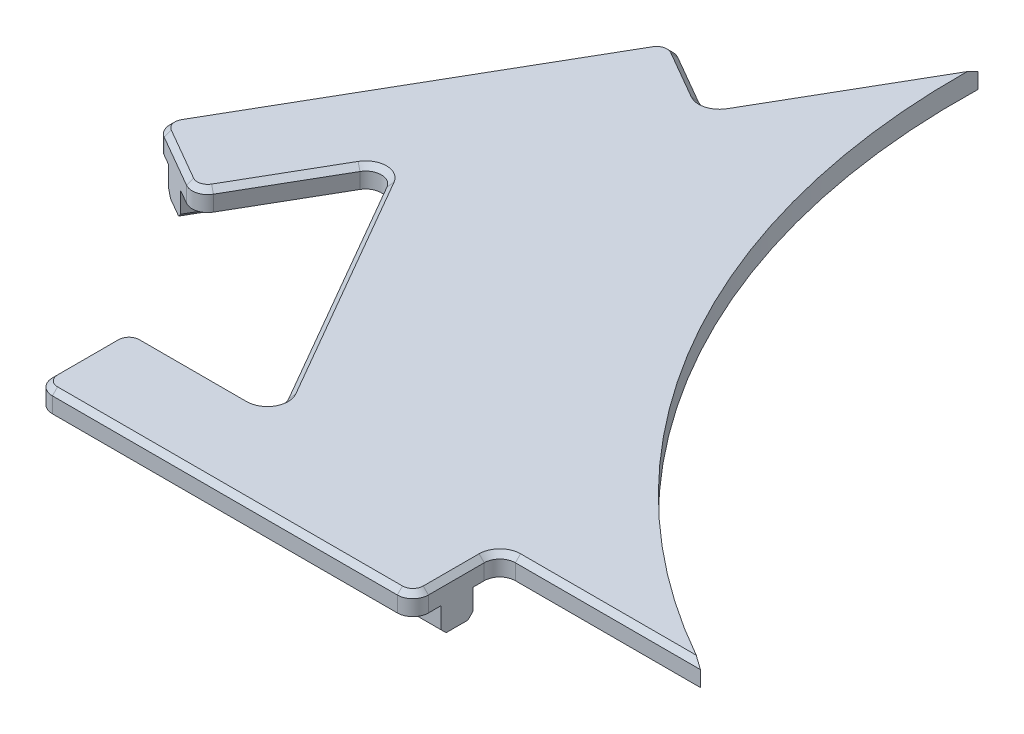
from build123d import *

# Parameters (mm, degrees)
BOSS_EXTRUDE1_DEPTH = 4
FILLET1_R           = 3
CUT_EXTRUDE1_DEPTH  = 209.07209361882713
FILLET4_R           = 3
CHAMFER1_SIZE       = 1
SKETCH3_R           = 140.00000000000003
CUT_EXTRUDE2_DEPTH  = 209.07209361882713
BOSS_EXTRUDE2_DEPTH = 5
CHAMFER2_SIZE       = 1


with BuildPart() as part:
    # Sketch1 → Boss-Extrude1 (new body)
    with BuildSketch(Plane(origin=(0, 0, 0), x_dir=(1, 0, 0), z_dir=(0, 1, 0))):
        Polygon((75.99999999999996, 9.99999999999996), (46.66025403784437, 60.8179306876173), (45.3612159321677, 61.5679306876173), (31.361215932167696, 37.31921938165302), (15.989265014993904, 46.19421938165303), (52.21426501499388, 108.93775988583559), (66.72019052838324, 100.56275988583559), (86.04510054636872, 134.0344858886832), (159.0998200359709, 7.499999999999965), (120.44999999999995, 7.499999999999969), (120.44999999999993, -9.250000000000043), (47.99999999999995, -9.250000000000043), (47.99999999999995, 8.499999999999957), (75.99999999999996, 8.499999999999961), align=None)
    extrude(amount=BOSS_EXTRUDE1_DEPTH)

    # Fillet1
    fillet1_edges = [part.edges().sort_by_distance(p)[0] for p in [
        (66.72019052838324, 2, -100.56275988583559),
        (120.44999999999995, 2, -7.499999999999969),
        (52.21426501499388, 2, -108.93775988583559),
        (15.989265014993904, 2, -46.19421938165303),
        (47.99999999999995, 2, -8.499999999999957),
        (47.99999999999995, 2, 9.250000000000043),
        (120.44999999999993, 2, 9.250000000000043),
        (31.361215932167696, 2, -37.31921938165302),
    ]]
    fillet(fillet1_edges, radius=FILLET1_R)

    # Sketch2 → Cut-Extrude1 (cut, through all)
    with BuildSketch(Plane(origin=(0, 4, 0), x_dir=(1, 0, 0), z_dir=(0, 1, 0))):
        Polygon((46.66025403784437, 60.8179306876173), (45.79422863405992, 62.31793068761731), (45.3612159321677, 61.5679306876173), align=None)
        Polygon((75.99999999999996, 8.499999999999961), (76.86602540378442, 8.49999999999996), (75.99999999999996, 9.99999999999996), align=None)
    extrude(amount=-CUT_EXTRUDE1_DEPTH, mode=Mode.SUBTRACT)

    # Fillet4
    fillet4_edges = [part.edges().sort_by_distance(p)[0] for p in [
        (76.86602540378442, 2, -8.49999999999996),
        (45.79422863405992, 2, -62.31793068761731),
    ]]
    fillet(fillet4_edges, radius=FILLET4_R)

    # Chamfer1
    chamfer1_edges = [part.edges().sort_by_distance(p)[0] for p in [
        (31.039596856121936, 4, -38.519518114139125),
        (23.6752404735808, 4, -41.75671938165303),
        (17.189563747480015, 4, -46.515838457698784),
        (34.10176501499389, 4, -77.5659896337443),
        (52.53588409103963, 4, -107.73746115334947),
        (59.467227771688556, 4, -104.75025988583559),
        (66.39857145233749, 4, -101.76305861832171),
        (77.13264553737598, 4, -118.59766099293606),
        (141.27491001798543, 4, -7.499999999999967),
        (121.3286796564403, 4, -6.621320343559613),
        (120.44999999999993, 4, 0.8750000000000417),
        (119.57132034355958, 4, 8.371320343559686),
        (84.22499999999994, 4, 9.250000000000043),
        (48.8786796564403, 4, 8.371320343559685),
        (47.99999999999995, 4, 0.37500000000004263),
        (48.878679656440305, 4, -7.621320343559599),
        (61.334936490538894, 4, -8.499999999999957),
        (74.26794919243115, 4, -9.99999999999997),
        (61.33012701892217, 4, -35.40896534380863),
        (45.79422863405992, 4, -59.31793068761731),
        (38.02868417743714, 4, -48.867613140311825),
    ]]
    chamfer(chamfer1_edges, length=CHAMFER1_SIZE)

    # Sketch3 → Cut-Extrude2 (cut, through all)
    with BuildSketch(Plane(origin=(0, 4, 0), x_dir=(1, 0, 0), z_dir=(0, 1, 0))):
        with Locations((225.99999999999997, 130.48116083685534)):
            Circle(SKETCH3_R)
    extrude(amount=-CUT_EXTRUDE2_DEPTH, mode=Mode.SUBTRACT)

    # Sketch4 → Boss-Extrude2 (add)
    with BuildSketch(Plane.XZ):
        Polygon((20.66580219542986, -43.49421938165304), (56.890802195429856, -106.2377598858356), (62.26015969889338, -103.13775988583556), (26.035159698893374, -40.394219381653016), (23.35048094716162, -41.944219381653035), align=None)
        Polygon((47.99999999999995, 0.7500000000000423), (47.99999999999995, 3.8500000000000423), (120.44999999999993, 3.8500000000000596), (120.44999999999993, -2.349999999999949), (47.99999999999995, -2.3499999999999575), align=None)
    extrude(amount=BOSS_EXTRUDE2_DEPTH)

    # Chamfer2
    chamfer2_edges = [part.edges().sort_by_distance(p)[0] for p in [
        (38.77830219542986, -5, -74.86598963374432),
        (44.14765969889338, -5, -71.76598963374428),
        (84.22499999999994, -5, 3.850000000000051),
        (84.22499999999994, -5, -2.3499999999999535),
    ]]
    chamfer(chamfer2_edges, length=CHAMFER2_SIZE)


solid = part.part
